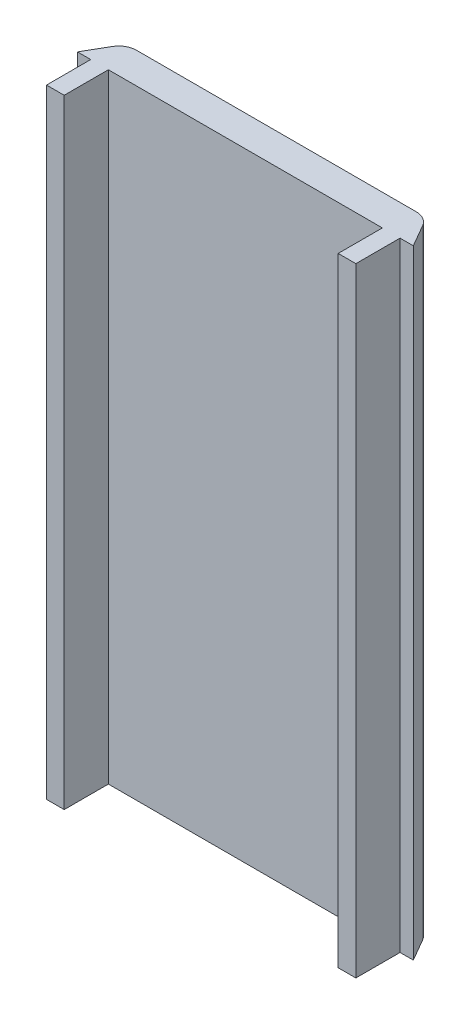
from build123d import *

# Parameters (mm, degrees)
BOSS_EXTRUDE1_DEPTH = 140
FILLET1_R           = 4


with BuildPart() as part:
    # Sketch1 → Boss-Extrude1 (new body)
    with BuildSketch(Plane(origin=(0, 0, 0), x_dir=(1, 0, 0), z_dir=(0, 1, 0))):
        Polygon((-9.215122984, 0), (-9.215122984, -10), (-5.215122984, -10), (-5.215122984, 0), (56.784877016, 0), (56.784877016, -10), (60.784877016, -10), (60.784877016, 0), (63.784877016, 0), (59.743425131, 7), (-8.1736711, 7), (-12.215122984, 0), align=None)
    extrude(amount=BOSS_EXTRUDE1_DEPTH)

    # Fillet1
    fillet1_edges = [part.edges().sort_by_distance(p)[0] for p in [
        (59.743425131, 70, -7),
        (-8.1736711, 70, -7),
    ]]
    fillet(fillet1_edges, radius=FILLET1_R)


solid = part.part
